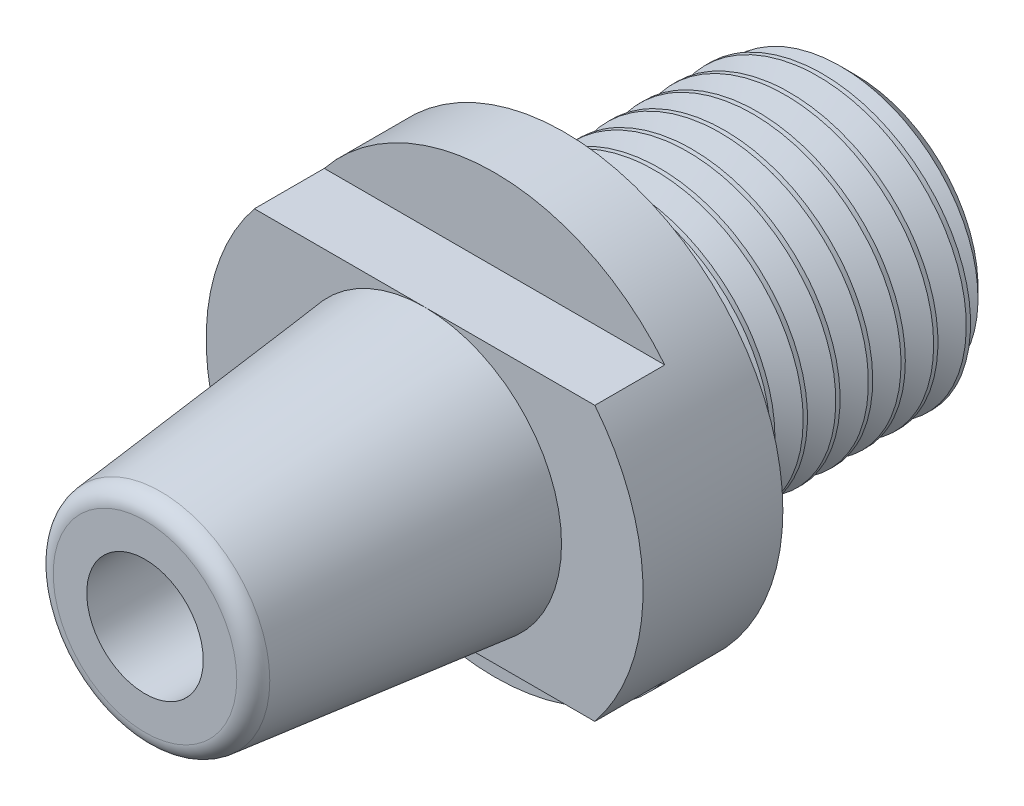
from build123d import *

# Parameters (mm, degrees)
SKETCH1_R           = 2.1
BOSS_EXTRUDE1_DEPTH = 5
SKETCH2_R           = 2.5
BOSS_EXTRUDE2_DEPTH = 4.5
CHAMFER1_SIZE       = 0.4
SKETCH3_R           = 3.75
BOSS_EXTRUDE3_DEPTH = 2.4
SKETCH4_W           = 9.396598556
SKETCH4_H           = 2.781572415
CUT_EXTRUDE1_DEPTH  = 1.2
SKETCH5_R           = 2.35
BOSS_EXTRUDE4_DEPTH = 4.8
BOSS_EXTRUDE4_TAPER = 6
SKETCH6_R           = 1
CUT_EXTRUDE2_DEPTH  = 10.8
SKETCH7_R           = 0.5
CUT_EXTRUDE3_DEPTH  = 6.2
FILLET1_R           = 0.3
CUT_SWEEP1_PITCH    = 0.56


with BuildPart() as part:
    # Sketch1 → Boss-Extrude1 (new body)
    with BuildSketch(Plane.XY):
        Circle(SKETCH1_R)
    extrude(amount=BOSS_EXTRUDE1_DEPTH)

    # Sketch2 → Boss-Extrude2 (add)
    with BuildSketch(Plane(origin=(0, 0, 0), x_dir=(-1, 0, 0), z_dir=(0, 0, -1))):
        Circle(SKETCH2_R)
    extrude(amount=-BOSS_EXTRUDE2_DEPTH)

    # Chamfer1
    chamfer1_edges = [part.edges().sort_by_distance(p)[0] for p in [
        (2.5, 0, 0),
    ]]
    chamfer(chamfer1_edges, length=CHAMFER1_SIZE)

    # Sketch3 → Boss-Extrude3 (add)
    with BuildSketch(Plane.XY.offset(5)):
        Circle(SKETCH3_R)
    extrude(amount=BOSS_EXTRUDE3_DEPTH)

    # Sketch4 → Cut-Extrude1 (cut)
    with BuildSketch(Plane.XY.offset(7.4)):
        with Locations((0, 3.740786208)):
            Rectangle(SKETCH4_W, SKETCH4_H)
    cut_extrude1 = extrude(amount=-CUT_EXTRUDE1_DEPTH, mode=Mode.SUBTRACT)

    # Mirror1: Cut-Extrude1 across plane
    add(cut_extrude1.mirror(Plane.ZX), mode=Mode.SUBTRACT)

    # Sketch5 → Boss-Extrude4 (add)
    with BuildSketch(Plane.XY.offset(7.4)):
        Circle(SKETCH5_R)
    extrude(amount=BOSS_EXTRUDE4_DEPTH, taper=BOSS_EXTRUDE4_TAPER)

    # Sketch6 → Cut-Extrude2 (cut)
    with BuildSketch(Plane.XY.offset(12.2)):
        Circle(SKETCH6_R)
    extrude(amount=-CUT_EXTRUDE2_DEPTH, mode=Mode.SUBTRACT)

    # Sketch7 → Cut-Extrude3 (cut)
    with BuildSketch(Plane(origin=(0, 0, 0), x_dir=(-1, 0, 0), z_dir=(0, 0, -1))):
        Circle(SKETCH7_R)
    extrude(amount=-CUT_EXTRUDE3_DEPTH, mode=Mode.SUBTRACT)

    # Fillet1
    fillet1_edges = [part.edges().sort_by_distance(p)[0] for p in [
        (-1.845499671, 0, 12.2),
    ]]
    fillet(fillet1_edges, radius=FILLET1_R)

    # Cut-Sweep1: the profile of Sketch9 screwed along a right-hand helix of 8 turns, 6 arcs to a turn; built about Z, then put on its axis
    cut_sweep1_z = Axis((0, 0, 0), (0, 0, 1))
    cut_sweep1_corners = [(2.079159734, -0.000223744, 0.006276005), (2.555473706, -0.010021464, 0.281101413), (2.555473706, 0.009573976, -0.268549402)]
    with BuildLine(mode=Mode.PRIVATE) as cut_sweep1_profile:
        Line(cut_sweep1_corners[0], cut_sweep1_corners[1])
        Line(cut_sweep1_corners[1], cut_sweep1_corners[2])
        Line(cut_sweep1_corners[2], cut_sweep1_corners[0])
    cut_sweep1_cap = Face(cut_sweep1_profile.wire())
    cut_sweep1_turn_angles = [0, 30, 60, 90, 120, 150, 180, 210, 240, 270, 300, 330, 360]
    cut_sweep1_turn_weights = [1, 0.8660254037844387, 1, 0.8660254037844387, 1, 0.8660254037844387, 1, 0.8660254037844387, 1, 0.8660254037844387, 1, 0.8660254037844387, 1]
    cut_sweep1_turn_rails = [Edge.make_bspline([Vector(p[0], p[1], 0).rotate(cut_sweep1_z, cut_sweep1_turn_angles[k]) / cut_sweep1_turn_weights[k] + Vector(0, 0, p[2] + CUT_SWEEP1_PITCH * cut_sweep1_turn_angles[k] / 360) for k in range(13)], [0, 0, 0, 1, 1, 2, 2, 3, 3, 4, 4, 5, 5, 6, 6, 6], 2, cut_sweep1_turn_weights) for p in cut_sweep1_corners]
    cut_sweep1_turn_sides = [Face.make_surface_from_curves(cut_sweep1_turn_rails[p[0]], cut_sweep1_turn_rails[p[1]]) for p in [(0, 1), (1, 2), (2, 0)]]
    cut_sweep1 = Plane(origin=(0, 0, 0), x_dir=(-1, 0, 0), z_dir=(0, 0, 1)) * Solid(Shell([*[p.moved(Location((0, 0, CUT_SWEEP1_PITCH * i))) for i in range(8) for p in cut_sweep1_turn_sides], cut_sweep1_cap, cut_sweep1_cap.rotate(cut_sweep1_z, 2880).moved(Location((0, 0, CUT_SWEEP1_PITCH * 2880 / 360)))]))
    add(cut_sweep1, mode=Mode.SUBTRACT)


solid = part.part
